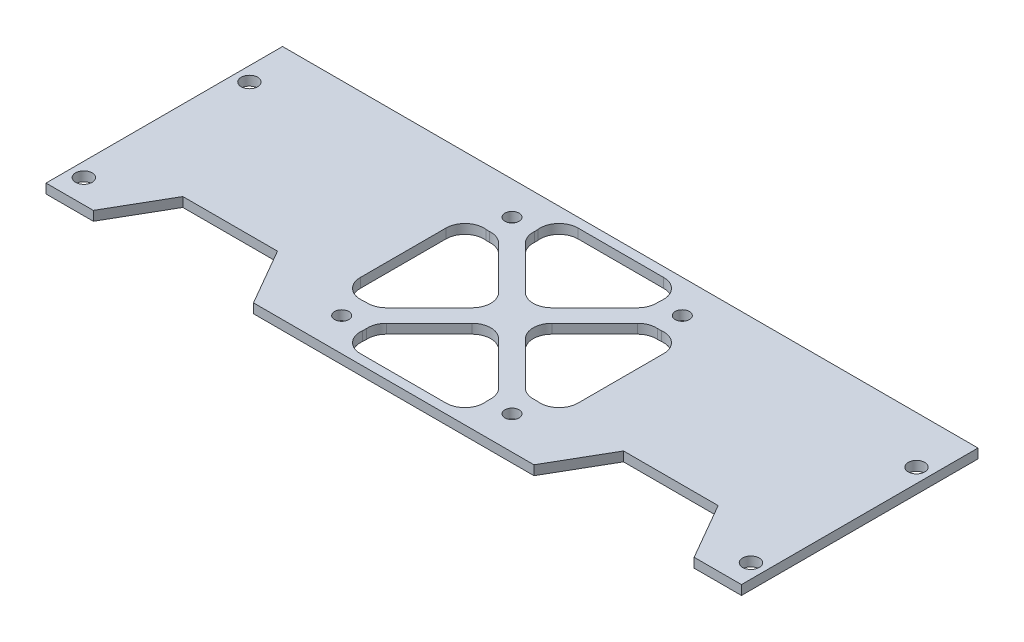
from build123d import *

# Parameters (mm, degrees)
SKETCH_1_W          = 147
SKETCH_1_H          = 50
SKETCH_1_R          = 1.5
EXTRUDE_1_DEPTH     = 2
CUT_EXTRUDE_1_DEPTH = 2
FILLET_2_DEPTH      = 2
FILLET_3_R          = 4
CUT_EXTRUDE_3_DEPTH = 78.661122835
SKETCH_7_R          = 1.75
CUT_EXTRUDE_4_DEPTH = 78.661122835


with BuildPart() as part:
    # 草图1 → 凸台-拉伸1 (new body)
    with BuildSketch(Plane(origin=(0, 0, 0), x_dir=(1, 0, 0), z_dir=(0, 1, 0))):
        Rectangle(SKETCH_1_W, SKETCH_1_H)
        with Locations(Location((18, -18, 0), (0, 0, 270))):
            Circle(SKETCH_1_R, mode=Mode.SUBTRACT)
        with Locations(Location((-18, -18, 0), (0, 0, 270))):
            Circle(SKETCH_1_R, mode=Mode.SUBTRACT)
        with Locations(Location((-18, 18, 0), (0, 0, 270))):
            Circle(SKETCH_1_R, mode=Mode.SUBTRACT)
        with Locations(Location((18, 18, 0), (0, 0, 270))):
            Circle(SKETCH_1_R, mode=Mode.SUBTRACT)
    extrude(amount=EXTRUDE_1_DEPTH)

    # 草图3 → 切除-拉伸1 (cut)
    with BuildSketch(Plane(origin=(0, 2, 0), x_dir=(1, 0, 0), z_dir=(0, 1, 0))):
        with BuildLine():
            Line((-13.345416088, 16.173843213), (0, 2.828427125))
            Line((0, 2.828427125), (13.345416088, 16.173843213))
            ThreePointArc((13.345416088, 16.173843213), (13.868972045, 20.816843629), (18, 23))
            Line((18, 23), (-18, 23))
            ThreePointArc((-18, 23), (-14.464466094, 21.535533906), (-13, 18))
            ThreePointArc((-13, 18), (-13.087112888, 17.070731352), (-13.345416088, 16.173843213))
        make_face()
        with BuildLine():
            Line((16.173843213, 13.345416088), (2.828427125, 0))
            Line((2.828427125, 0), (16.173843213, -13.345416088))
            ThreePointArc((16.173843213, -13.345416088), (20.816843629, -13.868972045), (23, -18))
            Line((23, -18), (23, 18))
            ThreePointArc((23, 18), (20.816843629, 13.868972045), (16.173843213, 13.345416088))
        make_face()
        with BuildLine():
            Line((0, -2.828427125), (-13.345416088, -16.173843213))
            ThreePointArc((-13.345416088, -16.173843213), (-13.087112888, -17.070731352), (-13, -18))
            ThreePointArc((-13, -18), (-14.464466094, -21.535533906), (-18, -23))
            Line((-18, -23), (18, -23))
            ThreePointArc((18, -23), (13.868972045, -20.816843629), (13.345416088, -16.173843213))
            Line((13.345416088, -16.173843213), (0, -2.828427125))
        make_face()
        with BuildLine():
            ThreePointArc((-23, -18), (-20.816843629, -13.868972045), (-16.173843213, -13.345416088))
            Line((-16.173843213, -13.345416088), (-2.828427125, 0))
            Line((-2.828427125, 0), (-16.173843213, 13.345416088))
            ThreePointArc((-16.173843213, 13.345416088), (-20.816843629, 13.868972045), (-23, 18))
            Line((-23, 18), (-23, -18))
        make_face()
    extrude(amount=-CUT_EXTRUDE_1_DEPTH, mode=Mode.SUBTRACT)

    # 圆角2: read off the stored shape, not the designer's step
    # 圆角2 outline → 圆角2 (add)
    with BuildSketch(Plane(origin=(0, 0, 0), x_dir=(1, 0, 0), z_dir=(0, 1, 0))):
        with BuildLine():
            Line((-23, 18), (-23, 9.05572809))
            ThreePointArc((-23, 9.05572809), (-21.666666667, 12.03715206), (-18.555555556, 13.03096005))
            ThreePointArc((-18.555555556, 13.03096005), (-21.726779962, 14.666666667), (-23, 18))
        make_face()
        with BuildLine():
            ThreePointArc((-18.555555556, -13.03096005), (-21.666666667, -12.03715206), (-23, -9.05572809))
            Line((-23, -9.05572809), (-23, -18))
            ThreePointArc((-23, -18), (-21.726779962, -14.666666667), (-18.555555556, -13.03096005))
        make_face()
        with BuildLine():
            ThreePointArc((13.03096005, -18.555555556), (12.03715206, -21.666666667), (9.05572809, -23))
            Line((9.05572809, -23), (18, -23))
            ThreePointArc((18, -23), (14.666666667, -21.726779962), (13.03096005, -18.555555556))
        make_face()
        with BuildLine():
            ThreePointArc((-9.05572809, -23), (-12.03715206, -21.666666667), (-13.03096005, -18.555555556))
            ThreePointArc((-13.03096005, -18.555555556), (-14.666666667, -21.726779962), (-18, -23))
            Line((-18, -23), (-9.05572809, -23))
        make_face()
        with BuildLine():
            ThreePointArc((18.555555556, 13.03096005), (21.666666667, 12.03715206), (23, 9.05572809))
            Line((23, 9.05572809), (23, 18))
            ThreePointArc((23, 18), (21.726779962, 14.666666667), (18.555555556, 13.03096005))
        make_face()
        with BuildLine():
            ThreePointArc((23, -9.05572809), (21.666666667, -12.03715206), (18.555555556, -13.03096005))
            ThreePointArc((18.555555556, -13.03096005), (21.726779962, -14.666666667), (23, -18))
            Line((23, -18), (23, -9.05572809))
        make_face()
        with BuildLine():
            ThreePointArc((-13.03096005, 18.555555556), (-12.03715206, 21.666666667), (-9.05572809, 23))
            Line((-9.05572809, 23), (-18, 23))
            ThreePointArc((-18, 23), (-14.666666667, 21.726779962), (-13.03096005, 18.555555556))
        make_face()
        with BuildLine():
            ThreePointArc((9.05572809, 23), (12.03715206, 21.666666667), (13.03096005, 18.555555556))
            ThreePointArc((13.03096005, 18.555555556), (14.666666667, 21.726779962), (18, 23))
            Line((18, 23), (9.05572809, 23))
        make_face()
    extrude(amount=FILLET_2_DEPTH)

    # 圆角3
    fillet_3_edges = [part.edges().sort_by_distance(p)[0] for p in [
        (13.345416088, 1, 16.173843213),
        (-13.345416088, 1, 16.173843213),
        (0, 1, 2.828427125),
        (16.173843213, 1, -13.345416088),
        (16.173843213, 1, 13.345416088),
        (2.828427125, 1, 0),
        (-16.173843213, 1, -13.345416088),
        (-2.828427125, 1, 0),
        (-16.173843213, 1, 13.345416088),
        (-13.345416088, 1, -16.173843213),
        (13.345416088, 1, -16.173843213),
        (0, 1, -2.828427125),
    ]]
    fillet(fillet_3_edges, radius=FILLET_3_R)

    # 草图6 → 切除-拉伸3 (cut, through all)
    with BuildSketch(Plane(origin=(0, 2, 0), x_dir=(1, 0, 0), z_dir=(0, 1, 0))):
        Polygon((63.5, -25), (56.57179677, -13), (36.57179677, -13), (29.643593539, -25), align=None)
    cut_extrude_3 = extrude(amount=-CUT_EXTRUDE_3_DEPTH, mode=Mode.SUBTRACT)

    # 镜向1: 切除-拉伸3 across plane
    add(cut_extrude_3.mirror(Plane(origin=(0, 0, 0), x_dir=(0, 0, 1), z_dir=(1, 0, 0))), mode=Mode.SUBTRACT)

    # 草图7 → 切除-拉伸4 (cut, through all)
    with BuildSketch(Plane.XZ):
        with Locations(Location((70.5, 20, 0), (0, 0, 270))):
            Circle(SKETCH_7_R)
        with Locations(Location((70.5, -15, 0), (0, 0, 270))):
            Circle(SKETCH_7_R)
        with Locations(Location((-70.5, -15, 0), (0, 0, 270))):
            Circle(SKETCH_7_R)
        with Locations(Location((-70.5, 20, 0), (0, 0, 270))):
            Circle(SKETCH_7_R)
    extrude(amount=-CUT_EXTRUDE_4_DEPTH, mode=Mode.SUBTRACT)


solid = part.part
